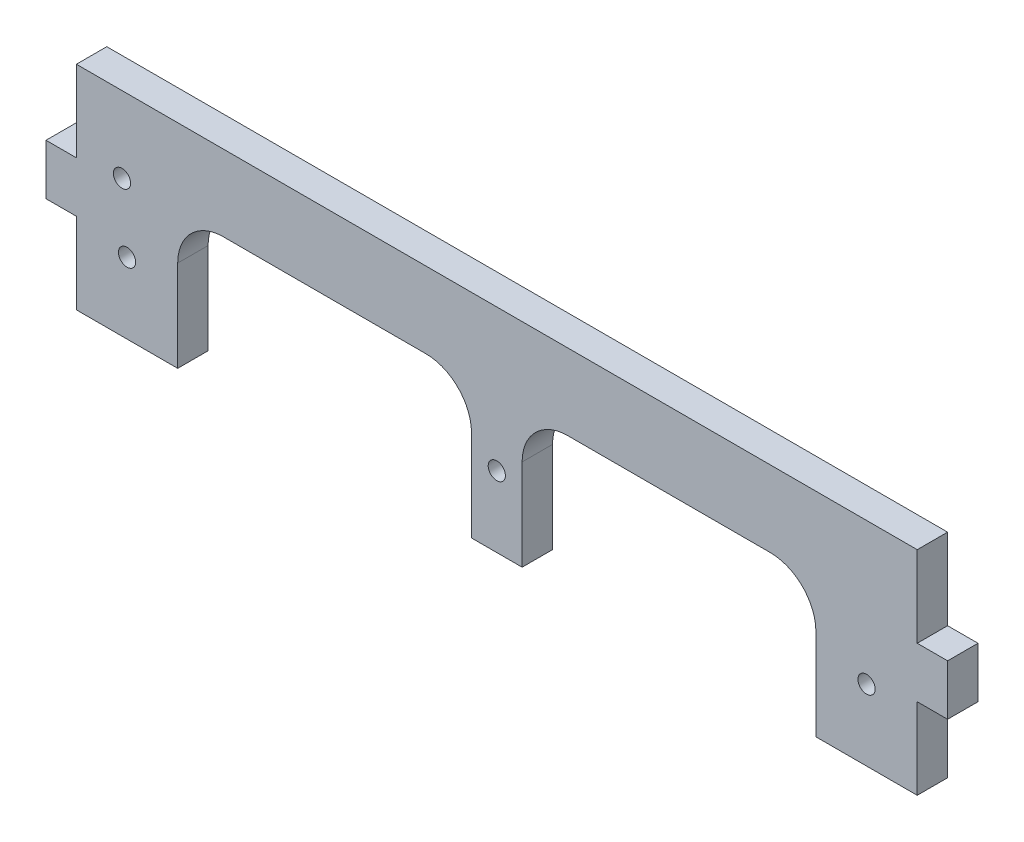
from build123d import *

# Parameters (mm, degrees)
BOSS_EXTRUDE1_DEPTH = 6
FILLET1_R           = 9
SKETCH2_R           = 1.7
CUT_EXTRUDE1_DEPTH  = 178.155299102
SKETCH3_R           = 1.7
CUT_EXTRUDE2_DEPTH  = 178.155299102


with BuildPart() as part:
    # Sketch1 → Boss-Extrude1 (new body)
    with BuildSketch(Plane.XY):
        Polygon((0, 0), (0, 16), (-6, 16), (-6, 26), (0, 26), (0, 42), (166, 42), (166, 26), (172, 26), (172, 16), (166, 16), (166, 0), (146, 0), (146, 27), (88, 27), (88, 0), (78, 0), (78, 27), (20, 27), (20, 0), align=None)
    extrude(amount=BOSS_EXTRUDE1_DEPTH)

    # Fillet1
    fillet1_edges = [part.edges().sort_by_distance(p)[0] for p in [
        (146, 27, 3),
        (88, 27, 3),
        (78, 27, 3),
        (20, 27, 3),
    ]]
    fillet(fillet1_edges, radius=FILLET1_R)

    # Sketch2 → Cut-Extrude1 (cut, through all)
    with BuildSketch(Plane.XY.offset(6)):
        with Locations((10, 14)):
            Circle(SKETCH2_R)
        with Locations((83, 14)):
            Circle(SKETCH2_R)
        with Locations((156, 14)):
            Circle(SKETCH2_R)
    extrude(amount=-CUT_EXTRUDE1_DEPTH, mode=Mode.SUBTRACT)

    # Sketch3 → Cut-Extrude2 (cut, through all)
    with BuildSketch(Plane.XY.offset(6)):
        with Locations((9, 27)):
            Circle(SKETCH3_R)
    extrude(amount=-CUT_EXTRUDE2_DEPTH, mode=Mode.SUBTRACT)


solid = part.part
